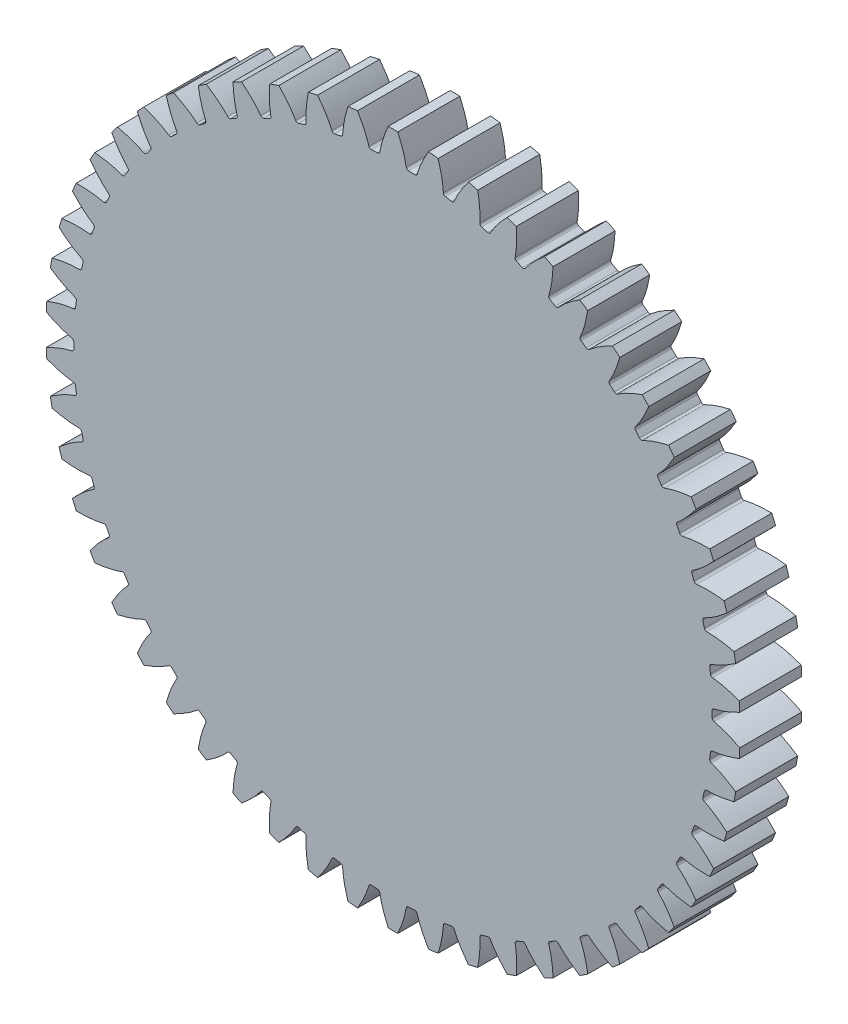
from build123d import *

# Parameters (mm, degrees)
CIRCLES_R                       = 56000
GEAR_EXTRUDE_DEPTH              = 10000
EXTRUDED_CUT2_DEPTH             = 79825.8081739
FILLET2_R                       = 380
CIRCULAR_PARTTERN2_COUNT        = 54
FILLET2_OF_CIRCULAR_PARTTERN2_R = 380


with BuildPart() as part:
    # circles → Gear_extrude (new body)
    with BuildSketch(Plane.XY):
        Circle(CIRCLES_R)
    extrude(amount=GEAR_EXTRUDE_DEPTH)

    # Db_Df → extruded-cut2 (cut, through all)
    with BuildSketch(Plane.XY.offset(10000)):
        with BuildLine():
            Line((78979.787898889, 51868.86565706), (108926.291448505, -8.41e-07))
            Line((108926.291448505, -8.41e-07), (78979.787898889, -51868.86565706))
            add(Edge.make_bspline(
                [(51493.498816669, -818.278447545), (51508.449515716, -821.115230483), (51552.23572874, -829.528029726), (51627.007885502, -844.408486721), (51750.555759631, -870.376689992), (51876.774592665, -898.842361324), (52009.778079256, -930.550599917), (52182.923499734, -974.063708277), (52384.142437597, -1027.699416064), (52660.745401105, -1107.266692183), (52993.76393742, -1211.702423237), (53347.3188242, -1331.971284077), (53715.005523825, -1466.836174274), (54079.59767943, -1609.791358768), (54441.123468163, -1760.309636029), (54840.809309815, -1936.060508019), (55280.954210204, -2141.1202089), (55760.036936437, -2378.203097284), (56276.350895709, -2650.007878012), (56789.447950094, -2936.034996671), (57295.863106705, -3233.717144656), (57795.63542481, -3542.417767937), (58288.79432591, -3861.565723434), (58775.374036837, -4190.649738091), (59255.409299539, -4529.208376941), (59728.928357482, -4876.8157456), (60195.964247613, -5233.085179307), (60656.544794165, -5597.65560571), (61110.702502915, -5970.196627218), (61558.464110797, -6350.395775044), (61999.864269382, -6737.968341733), (62434.924775353, -7132.636288755), (62863.678216818, -7534.147650945), (63286.150522629, -7942.258789986), (63702.371334699, -8356.743076824), (64112.368633868, -8777.384316107), (64516.170364227, -9203.977414272), (64916.833677697, -9639.620827859), (65409.102614343, -10190.4255417), (65986.842278454, -10861.633281731), (66642.484949693, -11659.260375693), (67364.457576987, -12586.141405379), (68062.557090851, -13531.123826866), (68736.992271871, -14493.131625124), (69387.968545524, -15471.159230859), (70015.689829134, -16464.265752805), (70620.358643459, -17471.568034755), (71202.176413303, -18492.23537784), (71761.342007454, -19525.481807596), (72298.054178266, -20570.56597039), (72812.507896656, -21626.780354387), (73304.897409609, -22693.453232022), (73775.418310103, -23769.950791741), (74224.260475682, -24855.659014614), (74651.616609855, -25950.000494335), (75057.677044187, -27052.4209445), (75442.629235961, -28162.384762229), (75806.661227068, -29279.383445112), (76149.95928662, -30402.926962481), (76472.70783654, -31532.542063405), (76775.090761621, -32667.774872854), (77057.291661953, -33808.191743414), (77319.492013187, -34953.370857906), (77561.872630763, -36102.907209426), (77784.612913378, -37256.408033479), (77987.891720591, -38413.496184587), (78171.886521017, -39573.805371304), (78336.773814888, -40736.981520976), (78482.729384496, -41902.683930696), (78625.82755558, -43216.567862307), (78757.72441927, -44679.170763605), (78869.136657645, -46290.75639853), (78936.462371624, -47757.784233748), (78969.490422419, -48932.120820575), (78982.063438587, -49739.672175654), (78985.828533923, -50143.477426092), (78987.28773609, -50437.160647012), (78987.698154037, -50602.35919032), (78987.800975719, -50712.492292829), (78987.772901271, -50804.270312719), (78987.682224238, -50877.693295114), (78987.523373243, -50951.116017205), (78987.296384254, -51024.538811506), (78987.001306222, -51097.960929429), (78986.638165037, -51171.383539674), (78986.207030388, -51244.804166111), (78985.707879168, -51318.228051979), (78985.140911768, -51391.641844792), (78984.50570927, -51465.083716094), (78983.891573541, -51529.258664287), (78983.319842076, -51584.510633833), (78982.821540539, -51630.022510196), (78982.400262827, -51666.91947266), (78981.95490156, -51704.327911713), (78981.511378876, -51740.283874951), (78981.062500454, -51775.529474571), (78980.541979702, -51814.619677499), (78980.140283606, -51843.825521275), (78979.906243037, -51860.522976511), (78979.787898889, -51868.86565706)],
                knots=[0.011069018, 0.011069018, 0.011069018, 0.011069018, 0.011069018, 0.011952952, 0.013658935, 0.015497399, 0.018402148, 0.019468433, 0.021601004, 0.025867446, 0.030497757, 0.036185538, 0.041871917, 0.047557872, 0.053244934, 0.058931584, 0.06461763, 0.072918199, 0.081447654, 0.0899777, 0.098507193, 0.107037359, 0.11556663, 0.124096778, 0.132626101, 0.141156186, 0.149685587, 0.158215633, 0.166745032, 0.175275001, 0.183804492, 0.192334414, 0.200864122, 0.209393853, 0.217923429, 0.226453242, 0.234982975, 0.243512747, 0.252042401, 0.260832261, 0.277891753, 0.294951121, 0.312010563, 0.329069998, 0.346129456, 0.363188878, 0.380248316, 0.397307721, 0.414367152, 0.431426617, 0.448486056, 0.465545589, 0.482604985, 0.499664311, 0.516723883, 0.533783197, 0.550842615, 0.567902066, 0.584961568, 0.602020943, 0.619080433, 0.636139827, 0.653199236, 0.670258683, 0.687318173, 0.704377604, 0.721436977, 0.738496452, 0.755555924, 0.772615305, 0.789674711, 0.815263901, 0.840853068, 0.866442183, 0.874971948, 0.883501612, 0.887766443, 0.889898859, 0.892031275, 0.893097503, 0.894163731, 0.895229958, 0.896296186, 0.897362414, 0.898428642, 0.899494869, 0.900561097, 0.901627325, 0.902693553, 0.90375978, 0.904826008, 0.905359122, 0.905892236, 0.90642535, 0.906958464, 0.907491577, 0.908024691, 0.908557805, 0.909090919, 0.909090919, 0.909090919, 0.909090919, 0.909090919], degree=4))
            ThreePointArc((51493.498816669, -818.278447545), (51500, 0), (51493.498816669, 818.278447545))
            add(Edge.make_bspline(
                [(51493.498816669, 818.278447545), (51508.449515716, 821.115230483), (51552.23572874, 829.528029726), (51627.007885502, 844.408486721), (51750.555759631, 870.376689992), (51876.774592665, 898.842361324), (52009.778079256, 930.550599917), (52182.923499734, 974.063708277), (52384.142437597, 1027.699416064), (52660.745401105, 1107.266692183), (52993.76393742, 1211.702423237), (53347.3188242, 1331.971284077), (53715.005523825, 1466.836174274), (54079.59767943, 1609.791358768), (54441.123468163, 1760.309636029), (54840.809309815, 1936.060508019), (55280.954210204, 2141.1202089), (55760.036936437, 2378.203097284), (56276.350895709, 2650.007878012), (56789.447950094, 2936.034996671), (57295.863106705, 3233.717144656), (57795.63542481, 3542.417767937), (58288.79432591, 3861.565723434), (58775.374036837, 4190.649738091), (59255.409299539, 4529.208376941), (59728.928357482, 4876.8157456), (60195.964247613, 5233.085179307), (60656.544794165, 5597.65560571), (61110.702502915, 5970.196627218), (61558.464110797, 6350.395775044), (61999.864269382, 6737.968341733), (62434.924775353, 7132.636288755), (62863.678216818, 7534.147650945), (63286.150522629, 7942.258789986), (63702.371334699, 8356.743076824), (64112.368633868, 8777.384316107), (64516.170364227, 9203.977414272), (64916.833677697, 9639.620827859), (65409.102614343, 10190.4255417), (65986.842278454, 10861.633281731), (66642.484949693, 11659.260375693), (67364.457576987, 12586.141405379), (68062.557090851, 13531.123826866), (68736.992271871, 14493.131625124), (69387.968545524, 15471.159230859), (70015.689829134, 16464.265752805), (70620.358643459, 17471.568034755), (71202.176413303, 18492.23537784), (71761.342007454, 19525.481807596), (72298.054178266, 20570.56597039), (72812.507896656, 21626.780354387), (73304.897409609, 22693.453232022), (73775.418310103, 23769.950791741), (74224.260475682, 24855.659014614), (74651.616609855, 25950.000494335), (75057.677044187, 27052.4209445), (75442.629235961, 28162.384762229), (75806.661227068, 29279.383445112), (76149.95928662, 30402.926962481), (76472.70783654, 31532.542063405), (76775.090761621, 32667.774872854), (77057.291661953, 33808.191743414), (77319.492013187, 34953.370857906), (77561.872630763, 36102.907209426), (77784.612913378, 37256.408033479), (77987.891720591, 38413.496184587), (78171.886521017, 39573.805371304), (78336.773814888, 40736.981520976), (78482.729384496, 41902.683930696), (78625.82755558, 43216.567862307), (78757.72441927, 44679.170763605), (78869.136657645, 46290.75639853), (78936.462371624, 47757.784233748), (78969.490422419, 48932.120820575), (78982.063438587, 49739.672175654), (78985.828533923, 50143.477426092), (78987.28773609, 50437.160647012), (78987.698154037, 50602.35919032), (78987.800975719, 50712.492292829), (78987.772901271, 50804.270312719), (78987.682224238, 50877.693295114), (78987.523373243, 50951.116017205), (78987.296384254, 51024.538811506), (78987.001306222, 51097.960929429), (78986.638165037, 51171.383539674), (78986.207030388, 51244.804166111), (78985.707879168, 51318.228051979), (78985.140911768, 51391.641844792), (78984.50570927, 51465.083716094), (78983.891573541, 51529.258664287), (78983.319842076, 51584.510633833), (78982.821540539, 51630.022510196), (78982.400262827, 51666.91947266), (78981.95490156, 51704.327911713), (78981.511378876, 51740.283874951), (78981.062500454, 51775.529474571), (78980.541979702, 51814.619677499), (78980.140283606, 51843.825521275), (78979.906243037, 51860.522976511), (78979.787898889, 51868.86565706)],
                knots=[0.011069018, 0.011069018, 0.011069018, 0.011069018, 0.011069018, 0.011952952, 0.013658935, 0.015497399, 0.018402148, 0.019468433, 0.021601004, 0.025867446, 0.030497757, 0.036185538, 0.041871917, 0.047557872, 0.053244934, 0.058931584, 0.06461763, 0.072918199, 0.081447654, 0.0899777, 0.098507193, 0.107037359, 0.11556663, 0.124096778, 0.132626101, 0.141156186, 0.149685587, 0.158215633, 0.166745032, 0.175275001, 0.183804492, 0.192334414, 0.200864122, 0.209393853, 0.217923429, 0.226453242, 0.234982975, 0.243512747, 0.252042401, 0.260832261, 0.277891753, 0.294951121, 0.312010563, 0.329069998, 0.346129456, 0.363188878, 0.380248316, 0.397307721, 0.414367152, 0.431426617, 0.448486056, 0.465545589, 0.482604985, 0.499664311, 0.516723883, 0.533783197, 0.550842615, 0.567902066, 0.584961568, 0.602020943, 0.619080433, 0.636139827, 0.653199236, 0.670258683, 0.687318173, 0.704377604, 0.721436977, 0.738496452, 0.755555924, 0.772615305, 0.789674711, 0.815263901, 0.840853068, 0.866442183, 0.874971948, 0.883501612, 0.887766443, 0.889898859, 0.892031275, 0.893097503, 0.894163731, 0.895229958, 0.896296186, 0.897362414, 0.898428642, 0.899494869, 0.900561097, 0.901627325, 0.902693553, 0.90375978, 0.904826008, 0.905359122, 0.905892236, 0.90642535, 0.906958464, 0.907491577, 0.908024691, 0.908557805, 0.909090919, 0.909090919, 0.909090919, 0.909090919, 0.909090919], degree=4))
        make_face()
    extruded_cut2 = extrude(amount=-EXTRUDED_CUT2_DEPTH, mode=Mode.SUBTRACT)

    # fillet2
    fillet2_edges = [part.edges().sort_by_distance(p)[0] for p in [
        (51493.498816669, -818.278447545, 5000),
        (51493.498816669, 818.278447545, 5000),
    ]]
    fillet(fillet2_edges, radius=FILLET2_R)

    # circular-parttern2: extruded-cut2 ×54 about axis
    circular_parttern2_axis = Axis((0, 0, 10000), (0, 0, -1))
    for i in range(1, CIRCULAR_PARTTERN2_COUNT):
        add(extruded_cut2.rotate(circular_parttern2_axis, i * 360 / CIRCULAR_PARTTERN2_COUNT), mode=Mode.SUBTRACT)

    # fillet2 of circular-parttern2
    fillet2_of_circular_parttern2_edges = [part.edges().sort_by_distance(p)[0] for p in [
        (51050.321869514, -6790.775877546, 5000),
        (51240.314528596, -5165.284794716, 5000),
        (49916.776895078, -12671.439713271, 5000),
        (50294.192888458, -11078.996421091, 5000),
        (48108.193144562, -18380.744064524, 5000),
        (48667.928568381, -16842.883626711, 5000),
        (45649.028610596, -23841.480384174, 5000),
        (46383.514003464, -22378.999724975, 5000),
        (42572.539274845, -28979.801581304, 5000),
        (43471.841981821, -27612.478242772, 5000),
        (38920.329377907, -33726.220676429, 5000),
        (39972.287872618, -32472.545361097, 5000),
        (34741.788793331, -38016.550493694, 5000),
        (35932.177141754, -36893.477009542, 5000),
        (30093.425114304, -41792.771682311, 5000),
        (31406.145356119, -40815.487671598, 5000),
        (25038.099485391, -45003.817328752, 5000),
        (26455.399331278, -44185.538881207, 5000),
        (19644.176513395, -47606.263549144, 5000),
        (21146.889414293, -46958.056477027, 5000),
        (13984.599753323, -49564.916722813, 5000),
        (15552.404095127, -49095.546914785, 5000),
        (8135.905271944, -50853.289425621, 5000),
        (9747.599190474, -50569.10430314, 5000),
        (2177.186628775, -51453.958626946, 5000),
        (3810.974728619, -51358.801306279, 5000),
        (-3810.974728619, -51358.801306279, 5000),
        (-2177.186628775, -51453.958626946, 5000),
        (-9747.599190474, -50569.10430314, 5000),
        (-8135.905271944, -50853.289425621, 5000),
        (-15552.404095127, -49095.546914785, 5000),
        (-13984.599753323, -49564.916722813, 5000),
        (-21146.889414293, -46958.056477027, 5000),
        (-19644.176513395, -47606.263549144, 5000),
        (-26455.399331278, -44185.538881207, 5000),
        (-25038.099485391, -45003.817328752, 5000),
        (-31406.145356119, -40815.487671598, 5000),
        (-30093.425114304, -41792.771682311, 5000),
        (-35932.177141754, -36893.477009542, 5000),
        (-34741.788793331, -38016.550493694, 5000),
        (-39972.287872618, -32472.545361097, 5000),
        (-38920.329377907, -33726.220676429, 5000),
        (-43471.841981821, -27612.478242772, 5000),
        (-42572.539274846, -28979.801581304, 5000),
        (-46383.514003464, -22378.999724975, 5000),
        (-45649.028610596, -23841.480384174, 5000),
        (-48667.928568381, -16842.883626711, 5000),
        (-48108.193144562, -18380.744064524, 5000),
        (-50294.192888458, -11078.996421091, 5000),
        (-49916.776895078, -12671.439713271, 5000),
        (-51240.314528596, -5165.284794716, 5000),
        (-51050.321869514, -6790.775877546, 5000),
        (-51493.498816669, 818.278447545, 5000),
        (-51493.498816669, -818.278447545, 5000),
        (-51050.321869514, 6790.775877547, 5000),
        (-51240.314528596, 5165.284794716, 5000),
        (-49916.776895078, 12671.439713271, 5000),
        (-50294.192888458, 11078.996421091, 5000),
        (-48108.193144562, 18380.744064524, 5000),
        (-48667.928568381, 16842.883626711, 5000),
        (-45649.028610596, 23841.480384174, 5000),
        (-46383.514003464, 22378.999724975, 5000),
        (-42572.539274845, 28979.801581304, 5000),
        (-43471.841981821, 27612.478242772, 5000),
        (-38920.329377907, 33726.220676429, 5000),
        (-39972.287872618, 32472.545361097, 5000),
        (-34741.788793331, 38016.550493694, 5000),
        (-35932.177141754, 36893.477009542, 5000),
        (-30093.425114304, 41792.771682311, 5000),
        (-31406.145356119, 40815.487671598, 5000),
        (-25038.099485391, 45003.817328752, 5000),
        (-26455.399331278, 44185.538881207, 5000),
        (-19644.176513395, 47606.263549144, 5000),
        (-21146.889414293, 46958.056477027, 5000),
        (-13984.599753323, 49564.916722813, 5000),
        (-15552.404095127, 49095.546914785, 5000),
        (-8135.905271944, 50853.289425621, 5000),
        (-9747.599190474, 50569.10430314, 5000),
        (-2177.186628775, 51453.958626946, 5000),
        (-3810.974728619, 51358.801306279, 5000),
        (3810.974728619, 51358.801306279, 5000),
        (2177.186628775, 51453.958626946, 5000),
        (9747.599190474, 50569.10430314, 5000),
        (8135.905271944, 50853.289425621, 5000),
        (15552.404095127, 49095.546914785, 5000),
        (13984.599753323, 49564.916722813, 5000),
        (21146.889414293, 46958.056477027, 5000),
        (19644.176513395, 47606.263549144, 5000),
        (26455.399331278, 44185.538881207, 5000),
        (25038.099485391, 45003.817328752, 5000),
        (31406.145356119, 40815.487671598, 5000),
        (30093.425114304, 41792.771682311, 5000),
        (35932.177141754, 36893.477009542, 5000),
        (34741.788793331, 38016.550493694, 5000),
        (39972.287872618, 32472.545361097, 5000),
        (38920.329377907, 33726.220676429, 5000),
        (43471.841981821, 27612.478242772, 5000),
        (42572.539274845, 28979.801581304, 5000),
        (46383.514003464, 22378.999724975, 5000),
        (45649.028610596, 23841.480384174, 5000),
        (48667.928568381, 16842.883626711, 5000),
        (48108.193144562, 18380.744064524, 5000),
        (50294.192888458, 11078.996421091, 5000),
        (49916.776895078, 12671.439713271, 5000),
        (51240.314528596, 5165.284794716, 5000),
        (51050.321869514, 6790.775877546, 5000),
    ]]
    fillet(fillet2_of_circular_parttern2_edges, radius=FILLET2_OF_CIRCULAR_PARTTERN2_R)


solid = part.part
